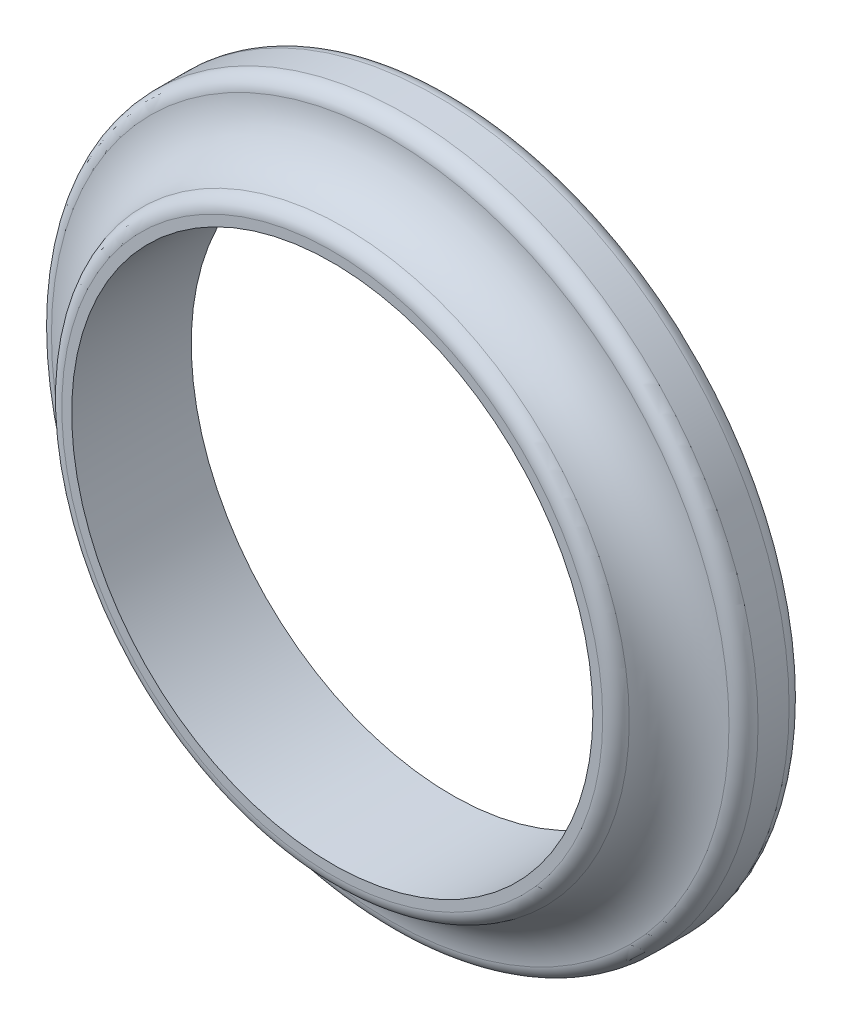
from build123d import *

# Parameters (mm, degrees)
SKETCH1_R               = 23
BOSS_EXTRUDE1_DEPTH     = 4
CUT_EXTRUDE1_DEPTH      = 33.771939216
CUT_EXTRUDE1_DEPTH_BACK = 33.771939216
SKETCH2_R               = 17
BOSS_EXTRUDE2_START     = 3.8
SKETCH3_R               = 18.5
SKETCH3_R_2             = 17
BOSS_EXTRUDE2_DEPTH     = 3.8
FILLET1_R               = 4
FILLET2_R               = 1
FILLET3_R               = 1


with BuildPart() as part:
    # Sketch1 → Boss-Extrude1 (new body)
    with BuildSketch(Plane.XY):
        Circle(SKETCH1_R)
    extrude(amount=BOSS_EXTRUDE1_DEPTH)

    # Sketch2 → Cut-Extrude1 (cut, two sides: drawn at the far end of the back side and taken through both)
    with BuildSketch(Plane.XY.offset(4).offset(-CUT_EXTRUDE1_DEPTH_BACK)):
        Circle(SKETCH2_R)
    extrude(amount=CUT_EXTRUDE1_DEPTH + CUT_EXTRUDE1_DEPTH_BACK, mode=Mode.SUBTRACT)

    # Sketch3 → Boss-Extrude2 (add)
    with BuildSketch(Plane.XY.offset(4).offset(BOSS_EXTRUDE2_START)):
        with Locations(Location((0, 0, 0), (0, 0, 180))):
            Circle(SKETCH3_R)
        Circle(SKETCH3_R_2, mode=Mode.SUBTRACT)
    extrude(amount=-BOSS_EXTRUDE2_DEPTH)

    # Fillet1
    # the kernel refuses this fillet: 4 mm, written as the material it adds along each edge
    with BuildSketch(Plane(origin=(0, 0, 4), x_dir=(-1, 0, 0), z_dir=(0, 1, 0))) as fillet1_piece_1:
        with BuildLine():
            CenterArc((22.494996871, 4), FILLET1_R, 182.865983983, 87.134016017)
            Line((18.5, 3.8), (18.420100063, 3.796))
            ThreePointArc((18.420100063, 3.796), (18.42, 1.9), (18.42, 0))
            Line((18.42, 0), (18.5, -0.08))
            Line((18.5, -0.08), (22.494996871, -0.08))
            Line((22.494996871, -0.08), (22.494996871, 0))
        make_face()
    revolve(axis=Axis((0, 0, 4), (0, 0, 1)))

    # Fillet2
    fillet2_edges = [part.edges().sort_by_distance(p)[0] for p in [
        (18.5, 0, 7.8),
    ]]
    fillet(fillet2_edges, radius=FILLET2_R)

    # Fillet3
    fillet3_edges = [part.edges().sort_by_distance(p)[0] for p in [
        (-23, 0, 0),
        (-23, 0, 4),
    ]]
    fillet(fillet3_edges, radius=FILLET3_R)


solid = part.part
